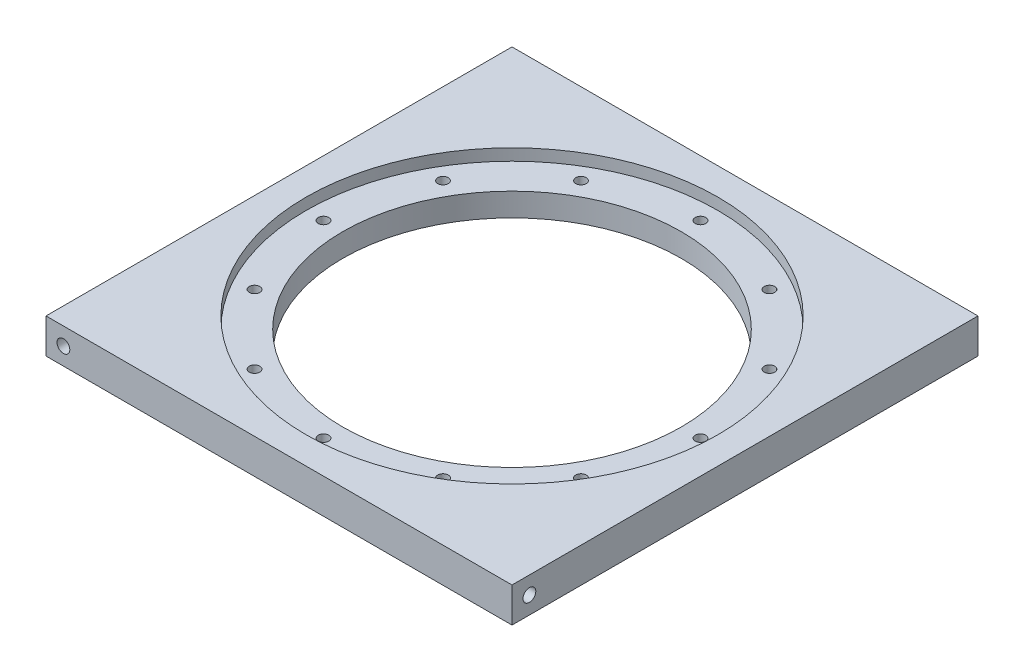
from build123d import *

# Parameters (mm, degrees)
SKETCH1_W           = 127.635
SKETCH1_H           = 127.635
BOSS_EXTRUDE1_DEPTH = 9.525
CUT_EXTRUDE1_DEPTH  = 9.525
SKETCH6_R           = 1.7526
F_6_32_HOLE1_DEPTH  = 6.35
SKETCH7_R           = 1.7526
F_6_32_HOLE2_DEPTH  = 6.35
SKETCH8_R           = 1.7526
F_6_32_HOLE3_DEPTH  = 6.35
SKETCH9_R           = 1.7526
F_6_32_HOLE4_DEPTH  = 6.35
SKETCH11_R          = 1.4351
CUT_EXTRUDE3_DEPTH  = 181.754286464
CIRPATTERN1_COUNT   = 12
SKETCH12_R          = 56.388
CUT_EXTRUDE4_DEPTH  = 3.175


with BuildPart() as part:
    # Sketch1 → Boss-Extrude1 (new body)
    with BuildSketch(Plane(origin=(0, 0, 0), x_dir=(1, 0, 0), z_dir=(0, 1, 0))):
        with Locations((63.8175, 63.8175)):
            Rectangle(SKETCH1_W, SKETCH1_H)
    extrude(amount=BOSS_EXTRUDE1_DEPTH)

    # Sketch5 → Cut-Extrude1 (cut)
    with BuildSketch(Plane(origin=(0, 9.525, 0), x_dir=(1, 0, 0), z_dir=(0, 1, 0))):
        with BuildLine():
            ThreePointArc((63.8175, 110.1725), (17.4625, 63.8175), (63.8175, 17.4625))
            Line((63.8175, 17.4625), (63.8175, 110.1725))
        make_face()
        with BuildLine():
            Line((63.8175, 110.1725), (63.8175, 17.4625))
            ThreePointArc((63.8175, 17.4625), (96.595434842, 31.039565158), (110.1725, 63.8175))
            ThreePointArc((110.1725, 63.8175), (96.595434842, 96.595434842), (63.8175, 110.1725))
        make_face()
        with BuildLine():
            ThreePointArc((63.8175, 110.1725), (17.4625, 63.8175), (63.8175, 17.4625))
            Line((63.8175, 17.4625), (63.8175, 110.1725))
        make_face()
        with BuildLine():
            Line((63.8175, 110.1725), (63.8175, 17.4625))
            ThreePointArc((63.8175, 17.4625), (96.595434842, 31.039565158), (110.1725, 63.8175))
            ThreePointArc((110.1725, 63.8175), (96.595434842, 96.595434842), (63.8175, 110.1725))
        make_face()
    extrude(amount=-CUT_EXTRUDE1_DEPTH, mode=Mode.SUBTRACT)

    # Sketch6 → 6-32 hole1 (cut)
    with BuildSketch(Plane(origin=(127.635, 0, 0), x_dir=(0, 0, -1), z_dir=(1, 0, 0))):
        with Locations((4.7625, 4.7625)):
            Circle(SKETCH6_R)
    extrude(amount=-F_6_32_HOLE1_DEPTH, mode=Mode.SUBTRACT)

    # Sketch7 → 6-32 hole2 (cut)
    with BuildSketch(Plane(origin=(0, 0, -127.635), x_dir=(-1, 0, 0), z_dir=(0, 0, -1))):
        with Locations((-122.8725, 4.7625)):
            Circle(SKETCH7_R)
    extrude(amount=-F_6_32_HOLE2_DEPTH, mode=Mode.SUBTRACT)

    # Sketch8 → 6-32 hole3 (cut)
    with BuildSketch(Plane.ZY):
        with Locations((-122.8725, 4.7625)):
            Circle(SKETCH8_R)
    extrude(amount=-F_6_32_HOLE3_DEPTH, mode=Mode.SUBTRACT)

    # Sketch9 → 6-32 hole4 (cut)
    with BuildSketch(Plane.XY):
        with Locations((4.7625, 4.7625)):
            Circle(SKETCH9_R)
    extrude(amount=-F_6_32_HOLE4_DEPTH, mode=Mode.SUBTRACT)

    # Sketch11 → Cut-Extrude3 (cut, through all)
    with BuildSketch(Plane(origin=(0, 9.525, 0), x_dir=(1, 0, 0), z_dir=(0, 1, 0))):
        with Locations((63.8175, 115.443)):
            Circle(SKETCH11_R)
    cut_extrude3 = extrude(amount=-CUT_EXTRUDE3_DEPTH, mode=Mode.SUBTRACT)

    # CirPattern1: Cut-Extrude3 ×12 about axis
    cirpattern1_axis = Axis((63.8175, 9.525, -63.8175), (0, 1, 0))
    for i in range(1, CIRPATTERN1_COUNT):
        add(cut_extrude3.rotate(cirpattern1_axis, i * 360 / CIRPATTERN1_COUNT), mode=Mode.SUBTRACT)

    # Sketch12 → Cut-Extrude4 (cut)
    with BuildSketch(Plane(origin=(0, 9.525, 0), x_dir=(1, 0, 0), z_dir=(0, 1, 0))):
        with Locations((63.8175, 63.8175)):
            Circle(SKETCH12_R)
    extrude(amount=-CUT_EXTRUDE4_DEPTH, mode=Mode.SUBTRACT)


solid = part.part
